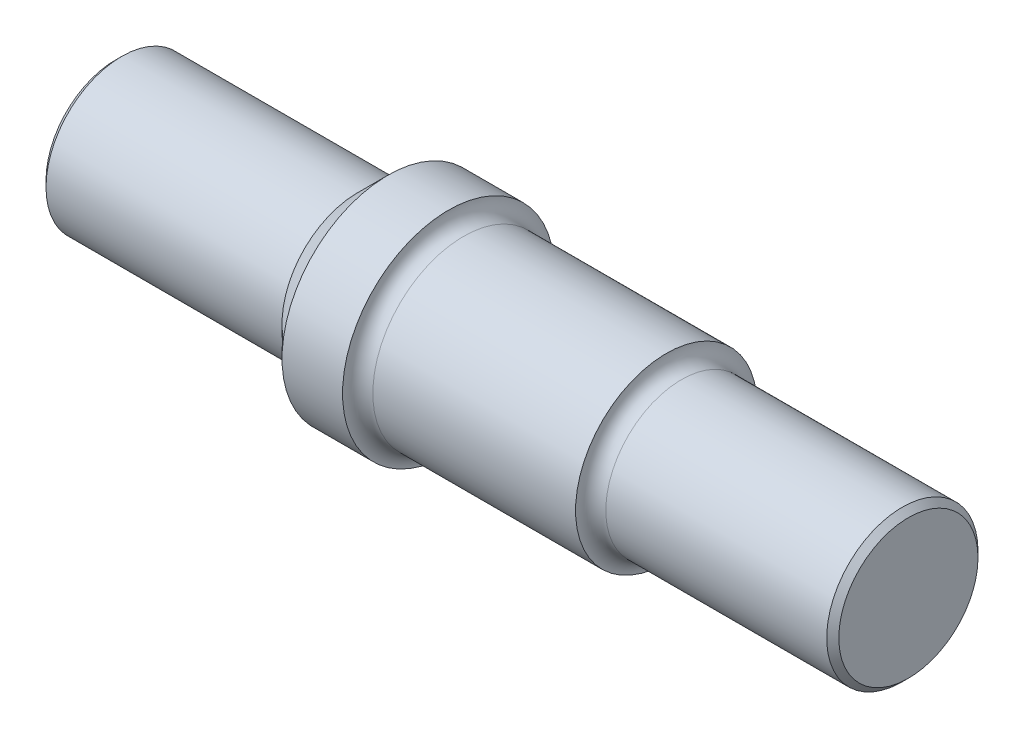
from build123d import *

# Parameters (mm, degrees)
FILLET1_R     = 2.5
CHAMFER2_SIZE = 1


with BuildPart() as part:
    # Sketch1 → Revolve1 (revolve)
    with BuildSketch(Plane.XY, mode=Mode.PRIVATE) as revolve1_sk:
        Polygon((0, 0), (0, 12.5), (40, 12.5), (45, 17.5), (55, 17.5), (55, 15), (91, 15), (91, 12.5), (131, 12.5), (131, 0), align=None)
    revolve(revolve1_sk.sketch.rotate(Axis((131, 0, 0), (-1, 0, 0)), 90), axis=Axis((131, 0, 0), (-1, 0, 0)))

    # Fillet1
    fillet1_edges = [part.edges().sort_by_distance(p)[0] for p in [
        (91, 0, 12.5),
        (55, 0, 15),
    ]]
    fillet(fillet1_edges, radius=FILLET1_R - 0.0001)  # a hair under: the kernel refuses the full size

    # Chamfer2
    chamfer2_edges = [part.edges().sort_by_distance(p)[0] for p in [
        (0, 0, 12.5),
        (131, 0, 12.5),
    ]]
    chamfer(chamfer2_edges, length=CHAMFER2_SIZE)


solid = part.part
